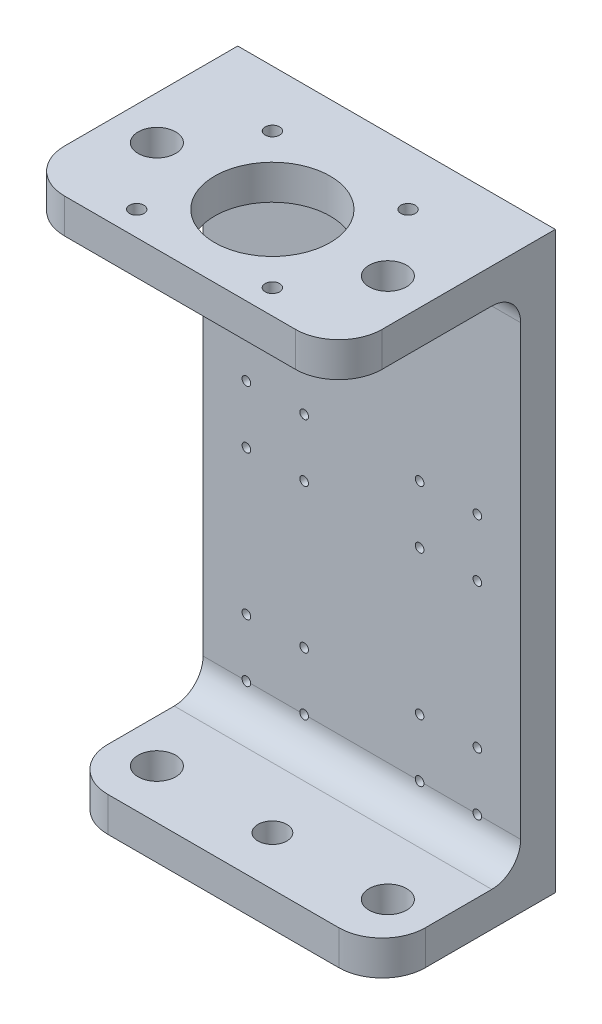
from build123d import *

# Parameters (mm, degrees)
SKETCH1_W           = 110
SKETCH1_H           = 175
SKETCH1_R           = 1.5
BOSS_EXTRUDE1_DEPTH = 12
SKETCH2_W           = 110
SKETCH2_H           = 12
BOSS_EXTRUDE2_DEPTH = 75
SKETCH2_3_W         = 110
SKETCH2_3_H         = 12
BOSS_EXTRUDE3_DEPTH = 60
SKETCH3_R           = 6.5
CUT_EXTRUDE1_DEPTH  = 240.428486192
CUT_EXTRUDE2_REACH  = 241.428
SKETCH3_3_R         = 2.5
SKETCH3_3_R_2       = 20
SKETCH3_4_R         = 5
CUT_EXTRUDE3_DEPTH  = 240.428486192
FILLET1_R           = 10
FILLET2_R           = 15


with BuildPart() as part:
    # Sketch1 → Boss-Extrude1 (new body)
    with BuildSketch(Plane.XY):
        with Locations((55, 87.5)):
            Rectangle(SKETCH1_W, SKETCH1_H)
        with Locations((95, 10)):
            Circle(SKETCH1_R, mode=Mode.SUBTRACT)
        with Locations((75, 10)):
            Circle(SKETCH1_R, mode=Mode.SUBTRACT)
        with Locations(Location((95, 30, 0), (0, 0, 180))):
            Circle(SKETCH1_R, mode=Mode.SUBTRACT)
        with Locations(Location((75, 30, 0), (0, 0, 180))):
            Circle(SKETCH1_R, mode=Mode.SUBTRACT)
        with Locations(Location((35, 10, 0), (0, 0, 180))):
            Circle(SKETCH1_R, mode=Mode.SUBTRACT)
        with Locations(Location((15, 10, 0), (0, 0, 180))):
            Circle(SKETCH1_R, mode=Mode.SUBTRACT)
        with Locations((15, 30)):
            Circle(SKETCH1_R, mode=Mode.SUBTRACT)
        with Locations((35, 30)):
            Circle(SKETCH1_R, mode=Mode.SUBTRACT)
        with Locations(Location((95, 100, 0), (0, 0, 180))):
            Circle(SKETCH1_R, mode=Mode.SUBTRACT)
        with Locations((95, 80)):
            Circle(SKETCH1_R, mode=Mode.SUBTRACT)
        with Locations((75, 80)):
            Circle(SKETCH1_R, mode=Mode.SUBTRACT)
        with Locations(Location((75, 100, 0), (0, 0, 180))):
            Circle(SKETCH1_R, mode=Mode.SUBTRACT)
        with Locations((35, 100)):
            Circle(SKETCH1_R, mode=Mode.SUBTRACT)
        with Locations((15, 100)):
            Circle(SKETCH1_R, mode=Mode.SUBTRACT)
        with Locations(Location((35, 80, 0), (0, 0, 180))):
            Circle(SKETCH1_R, mode=Mode.SUBTRACT)
        with Locations(Location((15, 80, 0), (0, 0, 180))):
            Circle(SKETCH1_R, mode=Mode.SUBTRACT)
    extrude(amount=BOSS_EXTRUDE1_DEPTH)

    # Sketch2 → Boss-Extrude2 (add)
    with BuildSketch(Plane(origin=(0, 0, 0), x_dir=(-1, 0, 0), z_dir=(0, 0, -1))):
        with Locations((-55, 181)):
            Rectangle(SKETCH2_W, SKETCH2_H)
    extrude(amount=-BOSS_EXTRUDE2_DEPTH)

    # Sketch2<3> → Boss-Extrude3 (add)
    with BuildSketch(Plane(origin=(0, 0, 0), x_dir=(-1, 0, 0), z_dir=(0, 0, -1))):
        with Locations((-55, -6)):
            Rectangle(SKETCH2_3_W, SKETCH2_3_H)
    extrude(amount=-BOSS_EXTRUDE3_DEPTH)

    # Sketch3 → Cut-Extrude1 (cut, through all)
    with BuildSketch(Plane(origin=(0, 187, 0), x_dir=(1, 0, 0), z_dir=(0, 1, 0))):
        with Locations(Location((15, -43, 0), (0, 0, 270))):
            Circle(SKETCH3_R)
        with Locations(Location((95, -43, 0), (0, 0, 270))):
            Circle(SKETCH3_R)
    extrude(amount=-CUT_EXTRUDE1_DEPTH, mode=Mode.SUBTRACT)

    # Sketch3<3> → Cut-Extrude2 (cut, up to next)
    with BuildSketch(Plane(origin=(0, 187, 0), x_dir=(1, 0, 0), z_dir=(0, 1, 0)), mode=Mode.PRIVATE) as cut_extrude2_sk1:
        with Locations(Location((31.5, -19.5, 0), (0, 0, 270))):
            Circle(SKETCH3_3_R)
    cut_extrude2_tool1 = extrude(cut_extrude2_sk1.sketch, amount=-CUT_EXTRUDE2_REACH, mode=Mode.PRIVATE) & part.part
    # Sketch3<3> → Cut-Extrude2 (cut, up to next)
    with BuildSketch(Plane(origin=(0, 187, 0), x_dir=(1, 0, 0), z_dir=(0, 1, 0)), mode=Mode.PRIVATE) as cut_extrude2_sk2:
        with Locations(Location((78.5, -19.5, 0), (0, 0, 270))):
            Circle(SKETCH3_3_R)
    cut_extrude2_tool2 = extrude(cut_extrude2_sk2.sketch, amount=-CUT_EXTRUDE2_REACH, mode=Mode.PRIVATE) & part.part
    # Sketch3<3> → Cut-Extrude2 (cut, up to next)
    with BuildSketch(Plane(origin=(0, 187, 0), x_dir=(1, 0, 0), z_dir=(0, 1, 0)), mode=Mode.PRIVATE) as cut_extrude2_sk3:
        with Locations(Location((31.5, -66.5, 0), (0, 0, 270))):
            Circle(SKETCH3_3_R)
    cut_extrude2_tool3 = extrude(cut_extrude2_sk3.sketch, amount=-CUT_EXTRUDE2_REACH, mode=Mode.PRIVATE) & part.part
    # Sketch3<3> → Cut-Extrude2 (cut, up to next)
    with BuildSketch(Plane(origin=(0, 187, 0), x_dir=(1, 0, 0), z_dir=(0, 1, 0)), mode=Mode.PRIVATE) as cut_extrude2_sk4:
        with Locations(Location((78.5, -66.5, 0), (0, 0, 270))):
            Circle(SKETCH3_3_R)
    cut_extrude2_tool4 = extrude(cut_extrude2_sk4.sketch, amount=-CUT_EXTRUDE2_REACH, mode=Mode.PRIVATE) & part.part
    # Sketch3<3> → Cut-Extrude2 (cut, up to next)
    with BuildSketch(Plane(origin=(0, 187, 0), x_dir=(1, 0, 0), z_dir=(0, 1, 0)), mode=Mode.PRIVATE) as cut_extrude2_sk5:
        with Locations(Location((55, -43, 0), (0, 0, 270))):
            Circle(SKETCH3_3_R_2)
    cut_extrude2_tool5 = extrude(cut_extrude2_sk5.sketch, amount=-CUT_EXTRUDE2_REACH, mode=Mode.PRIVATE) & part.part
    add(cut_extrude2_tool1.solids().sort_by_distance((31.5, 187, 19.5))[0], mode=Mode.SUBTRACT)
    add(cut_extrude2_tool2.solids().sort_by_distance((78.5, 187, 19.5))[0], mode=Mode.SUBTRACT)
    add(cut_extrude2_tool3.solids().sort_by_distance((31.5, 187, 66.5))[0], mode=Mode.SUBTRACT)
    add(cut_extrude2_tool4.solids().sort_by_distance((78.5, 187, 66.5))[0], mode=Mode.SUBTRACT)
    add(cut_extrude2_tool5.solids().sort_by_distance((55, 187, 43))[0], mode=Mode.SUBTRACT)

    # Sketch3<4> → Cut-Extrude3 (cut, through all)
    with BuildSketch(Plane(origin=(0, 187, 0), x_dir=(1, 0, 0), z_dir=(0, 1, 0))):
        with Locations(Location((55, -43, 0), (0, 0, 270))):
            Circle(SKETCH3_4_R)
    extrude(amount=-CUT_EXTRUDE3_DEPTH, mode=Mode.SUBTRACT)

    # Fillet1
    # the kernel refuses this fillet: 10 mm, written as the material it adds along each edge
    with BuildSketch(Plane(origin=(110, 175, 12), x_dir=(0, -1, 0), z_dir=(-1, 0, 0))) as fillet1_piece_1_section:
        with BuildLine():
            CenterArc((FILLET1_R, FILLET1_R), FILLET1_R, 180, 90)
            Line((0, FILLET1_R), (-FILLET1_R * 0.02, FILLET1_R))
            Line((-FILLET1_R * 0.02, FILLET1_R), (-FILLET1_R * 0.02, -FILLET1_R * 0.02))
            Line((-FILLET1_R * 0.02, -FILLET1_R * 0.02), (FILLET1_R, -FILLET1_R * 0.02))
            Line((FILLET1_R, -FILLET1_R * 0.02), (FILLET1_R, 0))
        make_face()
    fillet1_piece_1 = extrude(amount=110, mode=Mode.PRIVATE)
    fillet1_piece_1 = fillet1_piece_1 - Plane(origin=(78.5, 172.718411152, 19.5), x_dir=(0, 0, 1), z_dir=(0, 1, 0)) * Cylinder(2.5, 260, mode=Mode.PRIVATE)
    fillet1_piece_1 = fillet1_piece_1 - Plane(origin=(31.5, 172.718411152, 19.5), x_dir=(0, 0, 1), z_dir=(0, 1, 0)) * Cylinder(2.5, 260, mode=Mode.PRIVATE)
    add(fillet1_piece_1)
    with BuildSketch(Plane(origin=(0, 0, 12), x_dir=(0, 1, 0), z_dir=(1, 0, 0))) as fillet1_piece_2_section:
        with BuildLine():
            CenterArc((FILLET1_R, FILLET1_R), FILLET1_R, 180, 90)
            Line((0, FILLET1_R), (-FILLET1_R * 0.02, FILLET1_R))
            Line((-FILLET1_R * 0.02, FILLET1_R), (-FILLET1_R * 0.02, -FILLET1_R * 0.02))
            Line((-FILLET1_R * 0.02, -FILLET1_R * 0.02), (FILLET1_R, -FILLET1_R * 0.02))
            Line((FILLET1_R, -FILLET1_R * 0.02), (FILLET1_R, 0))
        make_face()
    fillet1_piece_2 = extrude(amount=110, mode=Mode.PRIVATE)
    fillet1_piece_2 = fillet1_piece_2 - Plane(origin=(95, 10, 14.266654876), x_dir=(1, 0, 0), z_dir=(0, 0, -1)) * Cylinder(1.5, 260, mode=Mode.PRIVATE)
    fillet1_piece_2 = fillet1_piece_2 - Plane(origin=(75, 10, 14.266654876), x_dir=(1, 0, 0), z_dir=(0, 0, -1)) * Cylinder(1.5, 260, mode=Mode.PRIVATE)
    fillet1_piece_2 = fillet1_piece_2 - Plane(origin=(35, 10, 14.266654876), x_dir=(-1, 0, 0), z_dir=(0, 0, -1)) * Cylinder(1.5, 260, mode=Mode.PRIVATE)
    fillet1_piece_2 = fillet1_piece_2 - Plane(origin=(15, 10, 14.266654876), x_dir=(-1, 0, 0), z_dir=(0, 0, -1)) * Cylinder(1.5, 260, mode=Mode.PRIVATE)
    add(fillet1_piece_2)

    # Fillet2
    fillet2_edges = [part.edges().sort_by_distance(p)[0] for p in [
        (110, 181, 75),
        (0, 181, 75),
        (110, -6, 60),
        (0, -6, 60),
    ]]
    fillet(fillet2_edges, radius=FILLET2_R)


solid = part.part
